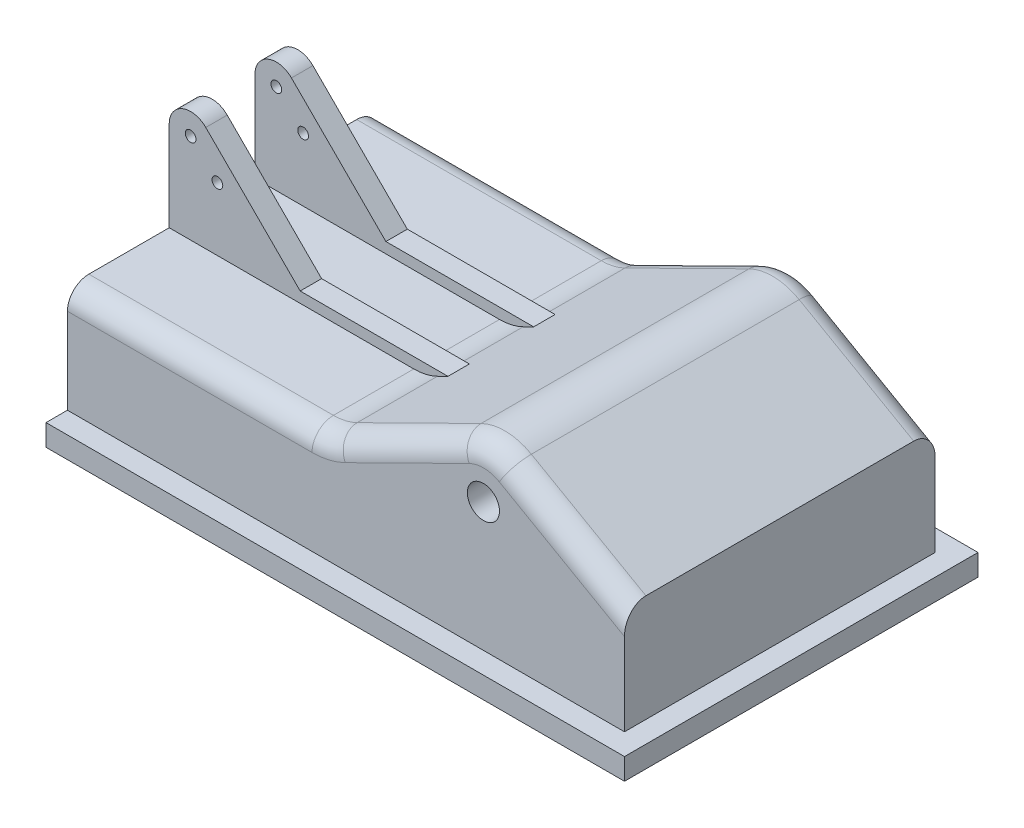
from build123d import *

# Parameters (mm, degrees)
SKETCH1_R           = 15
BOSS_EXTRUDE1_DEPTH = 145
BOSS_EXTRUDE2_START = 50
SKETCH2_R           = 5
BOSS_EXTRUDE2_DEPTH = 20
SHELL1_START        = -125
SHELL1_DEPTH        = 250
SKETCH4_W           = 520
SKETCH4_H           = 290
BOSS_EXTRUDE3_DEPTH = 20
FILLET1_R           = 20


# Read off the part's stored shape, not the designer's step: Shell1
with BuildPart() as part:
    # Sketch1 → Boss-Extrude1 (new, symmetric)
    with BuildSketch(Plane.XY):
        with BuildLine():
            Line((0, 0), (0, 120))
            Line((0, 120), (228.31744945, 120))
            ThreePointArc((228.31744945, 120), (239.69359838, 121.311364411), (250.473016236, 125.176670579))
            Line((250.473016236, 125.176670579), (366.167012988, 182.362651739))
            ThreePointArc((366.167012988, 182.362651739), (389.803653925, 187.517381697), (413.093568272, 180.972007347))
            Line((413.093568272, 180.972007347), (520, 120))
            Line((520, 120), (520, 0))
            Line((520, 0), (0, 0))
        make_face()
        with Locations((388.322579774, 140)):
            Circle(SKETCH1_R, mode=Mode.SUBTRACT)
    extrude(amount=BOSS_EXTRUDE1_DEPTH, both=True)

    # Sketch2 → Boss-Extrude2 (add)
    with BuildSketch(Plane.XY.offset(BOSS_EXTRUDE2_START)):
        with BuildLine():
            Line((0, 120), (0, 204))
            ThreePointArc((0, 204), (12.346331353, 222.47759065), (34.142135624, 218.142135624))
            Line((34.142135624, 218.142135624), (122.284271247, 130))
            Line((122.284271247, 130), (260.23118156, 130))
            Line((260.23118156, 130), (250.473016236, 125.176670579))
            ThreePointArc((250.473016236, 125.176670579), (239.69359838, 121.311364411), (228.31744945, 120))
            Line((228.31744945, 120), (0, 120))
        make_face()
        with Locations((20, 204)):
            Circle(SKETCH2_R, mode=Mode.SUBTRACT)
        with Locations((45, 179)):
            Circle(SKETCH2_R, mode=Mode.SUBTRACT)
    boss_extrude2 = extrude(amount=-BOSS_EXTRUDE2_DEPTH)

    # Mirror1: Boss-Extrude2 across plane
    add(boss_extrude2.mirror(Plane.XY))

    # Shell1 outline → Shell1 (cut)
    with BuildSketch(Plane.XY.offset(SHELL1_START)):
        with BuildLine():
            Line((356.937260838, 155.490698991), (259.33524295, 107.247338811))
            ThreePointArc((259.33524295, 107.247338811), (244.244057952, 101.835910175), (228.31744945, 100))
            Line((228.31744945, 100), (20, 100))
            Line((20, 100), (20, 0))
            Line((20, 0), (500, 0))
            Line((500, 0), (500, 108.382476706))
            Line((500, 108.382476706), (420.526102167, 153.708871052))
            ThreePointArc((420.526102167, 153.708871052), (387.342226815, 105.013732579), (356.937260838, 155.490698991))
        make_face()
    extrude(amount=SHELL1_DEPTH, mode=Mode.SUBTRACT)

    # Sketch4 → Boss-Extrude3 (add)
    # profile 1 of 2: a face of its own
    with BuildSketch(Plane.XZ):
        Polygon((540, 165), (0, 165), (0, 145), (520, 145), (520, -145), (0, -145), (0, -165), (540, -165), align=None)
    # profile 2 of 2: a face of its own
    with BuildSketch(Plane.XZ):
        with Locations((260, 0)):
            Rectangle(SKETCH4_W, SKETCH4_H)
        Polygon((20, 125), (228.31744945, 125), (259.33524295, 125), (353.322579774, 125), (356.937260838, 125), (420.526102167, 125), (423.322579774, 125), (500, 125), (500, -125), (423.322579774, -125), (420.526102167, -125), (356.937260838, -125), (353.322579774, -125), (259.33524295, -125), (228.31744945, -125), (20, -125), align=None, mode=Mode.SUBTRACT)
    extrude(amount=-BOSS_EXTRUDE3_DEPTH)

    # Fillet1
    fillet1_edges = [part.edges().sort_by_distance(p)[0] for p in [
        (389.803653925, 187.517381697, -145),
        (466.546784136, 150.486003673, -145),
        (466.546784136, 150.486003673, 145),
        (389.803653925, 187.517381697, 145),
        (308.320014612, 153.769661159, 145),
        (239.69359838, 121.311364411, 145),
        (114.158724725, 120, 145),
        (114.158724725, 120, -145),
        (239.69359838, 121.311364411, -145),
        (308.320014612, 153.769661159, -145),
    ]]
    fillet(fillet1_edges, radius=FILLET1_R)


solid = part.part
